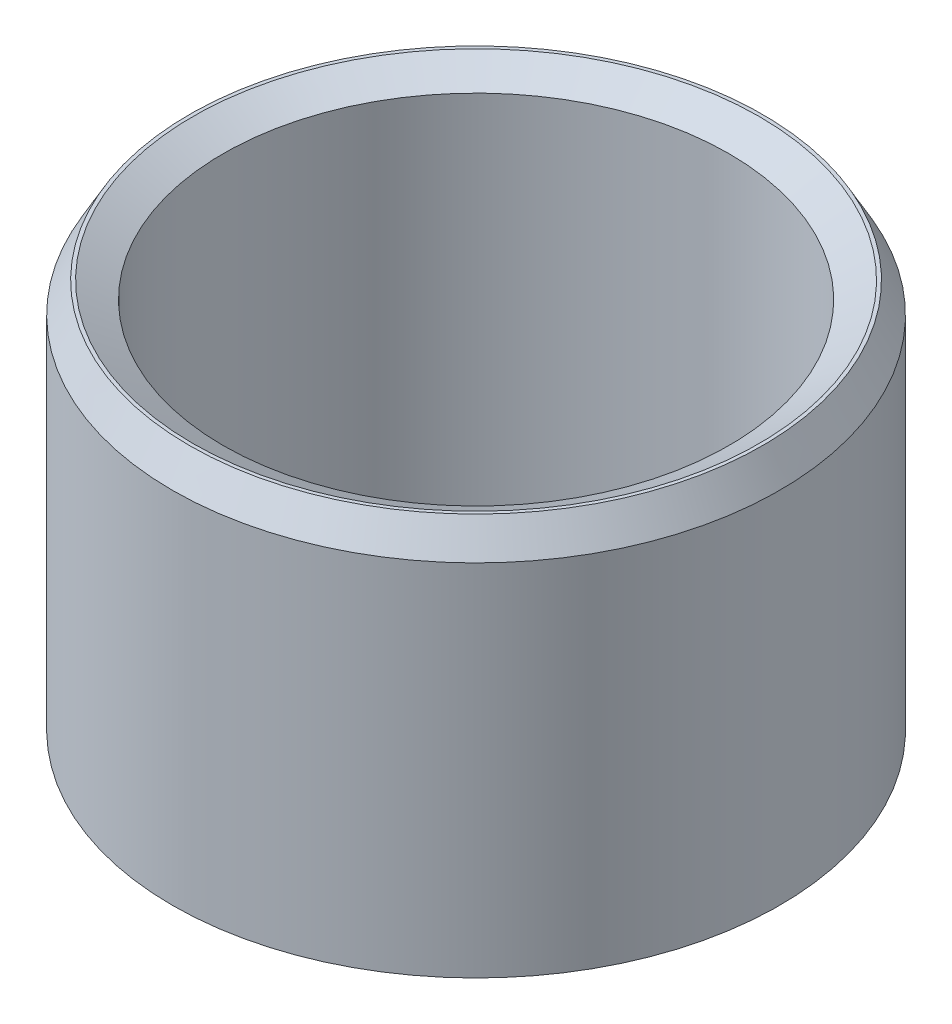
from build123d import *
from OCP.BRepFilletAPI import BRepFilletAPI_MakeChamfer

# Parameters (mm, degrees)
SKETCH1_R           = 37.5
BOSS_EXTRUDE1_DEPTH = 50.227721232
SKETCH2_R           = 31.230538575
CUT_EXTRUDE1_DEPTH  = 74.04330209
CHAMFER1_SIZE       = 3.743267813
CHAMFER1_SIZE2      = 2.093056941


with BuildPart() as part:
    # Sketch1 → Boss-Extrude1 (new body)
    with BuildSketch(Plane(origin=(0, 0, 0), x_dir=(1, 0, 0), z_dir=(0, 1, 0))):
        Circle(SKETCH1_R)
    extrude(amount=BOSS_EXTRUDE1_DEPTH)

    # Sketch2 → Cut-Extrude1 (cut, through all)
    with BuildSketch(Plane(origin=(0, 0, 0), x_dir=(1, 0, 0), z_dir=(0, 1, 0))):
        Circle(SKETCH2_R)
    extrude(amount=CUT_EXTRUDE1_DEPTH, mode=Mode.SUBTRACT)

    # Chamfer1: one chamfer whose edges measure the first distance from different faces: ONE call of the kernel's chamfer builder (chamfer() names one face for all edges)
    chamfer1_edges_1 = [part.edges().sort_by_distance(p)[0] for p in [
        (-31.230538575, 50.227721232, 0),
    ]]
    chamfer1_side_1 = [part.faces().sort_by_distance(p)[0] for p in [
        (-36.439339828, 50.227721232, 0),
    ]]
    chamfer1_edges_2 = [part.edges().sort_by_distance(p)[0] for p in [
        (-31.230538575, 0, 0),
    ]]
    chamfer1_side_2 = [part.faces().sort_by_distance(p)[0] for p in [
        (-31.230538575, 25.113860616, 0),
    ]]
    chamfer1_edges_3 = [part.edges().sort_by_distance(p)[0] for p in [
        (-37.5, 0, 0),
    ]]
    chamfer1_side_3 = [part.faces().sort_by_distance(p)[0] for p in [
        (-36.439339828, 0, 0),
    ]]
    chamfer1_edges_4 = [part.edges().sort_by_distance(p)[0] for p in [
        (-37.5, 50.227721232, 0),
    ]]
    chamfer1_side_4 = [part.faces().sort_by_distance(p)[0] for p in [
        (-37.5, 25.113860616, 0),
    ]]
    chamfer1 = BRepFilletAPI_MakeChamfer(part.part.solid().wrapped)
    for e in chamfer1_edges_1:
        chamfer1.Add(CHAMFER1_SIZE, CHAMFER1_SIZE2, e.wrapped, chamfer1_side_1[0].wrapped)  # the first distance lies on this face
    for e in chamfer1_edges_2:
        chamfer1.Add(CHAMFER1_SIZE, CHAMFER1_SIZE2, e.wrapped, chamfer1_side_2[0].wrapped)  # the first distance lies on this face
    for e in chamfer1_edges_3:
        chamfer1.Add(CHAMFER1_SIZE, CHAMFER1_SIZE2, e.wrapped, chamfer1_side_3[0].wrapped)  # the first distance lies on this face
    for e in chamfer1_edges_4:
        chamfer1.Add(CHAMFER1_SIZE, CHAMFER1_SIZE2, e.wrapped, chamfer1_side_4[0].wrapped)  # the first distance lies on this face
    add(Compound.cast(chamfer1.Shape()), mode=Mode.REPLACE)


solid = part.part
